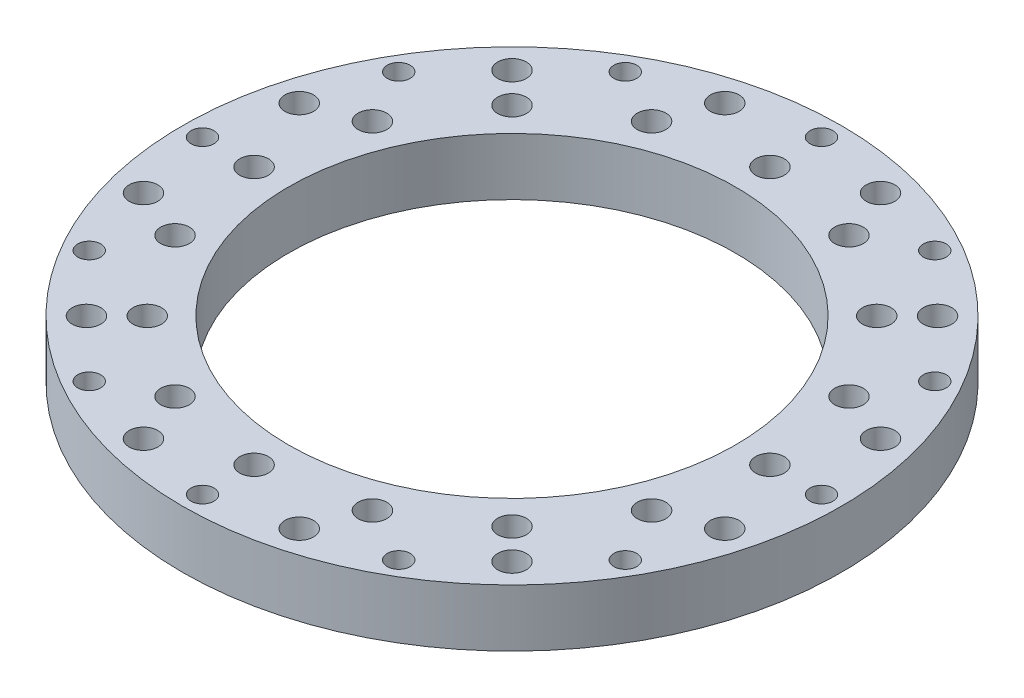
from build123d import *

# Parameters (mm, degrees)
SKETCH1_R           = 57.5
SKETCH1_R_2         = 39
SKETCH1_R_3         = 2
SKETCH1_R_4         = 2.5
BOSS_EXTRUDE1_DEPTH = 10
SKETCH2_R           = 2.5
CUT_EXTRUDE1_DEPTH  = 10
SKETCH4_R           = 5
SKETCH4_R_2         = 2.5
BOSS_EXTRUDE3_DEPTH = 0.4


with BuildPart() as part:
    # Sketch1 → Boss-Extrude1 (new body)
    with BuildSketch(Plane(origin=(0, 0, 0), x_dir=(1, 0, 0), z_dir=(0, 1, 0))):
        Circle(SKETCH1_R)
        Circle(SKETCH1_R_2, mode=Mode.SUBTRACT)
        with Locations((0, 54)):
            Circle(SKETCH1_R_3, mode=Mode.SUBTRACT)
        with Locations((27, 46.765371804)):
            Circle(SKETCH1_R_3, mode=Mode.SUBTRACT)
        with Locations((46.765371804, 27)):
            Circle(SKETCH1_R_3, mode=Mode.SUBTRACT)
        with Locations((54, 0)):
            Circle(SKETCH1_R_3, mode=Mode.SUBTRACT)
        with Locations((46.765371804, -27)):
            Circle(SKETCH1_R_3, mode=Mode.SUBTRACT)
        with Locations((27, -46.765371804)):
            Circle(SKETCH1_R_3, mode=Mode.SUBTRACT)
        with Locations((0, -54)):
            Circle(SKETCH1_R_3, mode=Mode.SUBTRACT)
        with Locations((-27, -46.765371804)):
            Circle(SKETCH1_R_3, mode=Mode.SUBTRACT)
        with Locations((-46.765371804, -27)):
            Circle(SKETCH1_R_3, mode=Mode.SUBTRACT)
        with Locations((-54, 0)):
            Circle(SKETCH1_R_3, mode=Mode.SUBTRACT)
        with Locations((-46.765371804, 27)):
            Circle(SKETCH1_R_3, mode=Mode.SUBTRACT)
        with Locations((-27, 46.765371804)):
            Circle(SKETCH1_R_3, mode=Mode.SUBTRACT)
        with Locations((13.587999868, 50.71110588)):
            Circle(SKETCH1_R_4, mode=Mode.SUBTRACT)
        with Locations((37.123106012, 37.123106012)):
            Circle(SKETCH1_R_4, mode=Mode.SUBTRACT)
        with Locations((50.71110588, 13.587999868)):
            Circle(SKETCH1_R_4, mode=Mode.SUBTRACT)
        with Locations((50.71110588, -13.587999868)):
            Circle(SKETCH1_R_4, mode=Mode.SUBTRACT)
        with Locations((37.123106012, -37.123106012)):
            Circle(SKETCH1_R_4, mode=Mode.SUBTRACT)
        with Locations((13.587999868, -50.71110588)):
            Circle(SKETCH1_R_4, mode=Mode.SUBTRACT)
        with Locations((-13.587999868, -50.71110588)):
            Circle(SKETCH1_R_4, mode=Mode.SUBTRACT)
        with Locations((-37.123106012, -37.123106012)):
            Circle(SKETCH1_R_4, mode=Mode.SUBTRACT)
        with Locations((-50.71110588, -13.587999868)):
            Circle(SKETCH1_R_4, mode=Mode.SUBTRACT)
        with Locations((-50.71110588, 13.587999868)):
            Circle(SKETCH1_R_4, mode=Mode.SUBTRACT)
        with Locations((-37.123106012, 37.123106012)):
            Circle(SKETCH1_R_4, mode=Mode.SUBTRACT)
        with Locations((-13.587999868, 50.71110588)):
            Circle(SKETCH1_R_4, mode=Mode.SUBTRACT)
    extrude(amount=BOSS_EXTRUDE1_DEPTH)

    # Sketch2 → Cut-Extrude1 (cut)
    with BuildSketch(Plane(origin=(0, 10, 0), x_dir=(1, 0, 0), z_dir=(0, 1, 0))):
        with Locations((0, 45)):
            Circle(SKETCH2_R)
        with Locations((17.220754456, 41.574578963)):
            Circle(SKETCH2_R)
        with Locations((31.819805153, 31.819805153)):
            Circle(SKETCH2_R)
        with Locations((41.574578963, 17.220754456)):
            Circle(SKETCH2_R)
        with Locations((45, 0)):
            Circle(SKETCH2_R)
        with Locations((41.574578963, -17.220754456)):
            Circle(SKETCH2_R)
        with Locations((31.819805153, -31.819805153)):
            Circle(SKETCH2_R)
        with Locations((17.220754456, -41.574578963)):
            Circle(SKETCH2_R)
        with Locations((0, -45)):
            Circle(SKETCH2_R)
        with Locations((-17.220754456, -41.574578963)):
            Circle(SKETCH2_R)
        with Locations((-31.819805153, -31.819805153)):
            Circle(SKETCH2_R)
        with Locations((-41.574578963, -17.220754456)):
            Circle(SKETCH2_R)
        with Locations((-45, 0)):
            Circle(SKETCH2_R)
        with Locations((-41.574578963, 17.220754456)):
            Circle(SKETCH2_R)
        with Locations((-31.819805153, 31.819805153)):
            Circle(SKETCH2_R)
        with Locations((-17.220754456, 41.574578963)):
            Circle(SKETCH2_R)
    extrude(amount=-CUT_EXTRUDE1_DEPTH, mode=Mode.SUBTRACT)

    # Sketch4 → Boss-Extrude3 (add)
    # profile 1 of 16: a face of its own
    with BuildSketch(Plane(origin=(0, 0, 0), x_dir=(1, 0, 0), z_dir=(0, 1, 0))):
        with Locations((0, 45)):
            Circle(SKETCH4_R)
        with Locations((0, 45)):
            Circle(SKETCH4_R_2, mode=Mode.SUBTRACT)
    # profile 2 of 16: a face of its own
    with BuildSketch(Plane(origin=(0, 0, 0), x_dir=(1, 0, 0), z_dir=(0, 1, 0))):
        with Locations((17.220754456, 41.574578963)):
            Circle(SKETCH4_R)
        with Locations((17.220754456, 41.574578963)):
            Circle(SKETCH4_R_2, mode=Mode.SUBTRACT)
    # profile 3 of 16: a face of its own
    with BuildSketch(Plane(origin=(0, 0, 0), x_dir=(1, 0, 0), z_dir=(0, 1, 0))):
        with Locations((31.819805153, 31.819805153)):
            Circle(SKETCH4_R)
        with Locations((31.819805153, 31.819805153)):
            Circle(SKETCH4_R_2, mode=Mode.SUBTRACT)
    # profile 4 of 16: a face of its own
    with BuildSketch(Plane(origin=(0, 0, 0), x_dir=(1, 0, 0), z_dir=(0, 1, 0))):
        with Locations((41.574578963, 17.220754456)):
            Circle(SKETCH4_R)
        with Locations((41.574578963, 17.220754456)):
            Circle(SKETCH4_R_2, mode=Mode.SUBTRACT)
    # profile 5 of 16: a face of its own
    with BuildSketch(Plane(origin=(0, 0, 0), x_dir=(1, 0, 0), z_dir=(0, 1, 0))):
        with Locations((45, 0)):
            Circle(SKETCH4_R)
        with Locations((45, 0)):
            Circle(SKETCH4_R_2, mode=Mode.SUBTRACT)
    # profile 6 of 16: a face of its own
    with BuildSketch(Plane(origin=(0, 0, 0), x_dir=(1, 0, 0), z_dir=(0, 1, 0))):
        with Locations((41.574578963, -17.220754456)):
            Circle(SKETCH4_R)
        with Locations((41.574578963, -17.220754456)):
            Circle(SKETCH4_R_2, mode=Mode.SUBTRACT)
    # profile 7 of 16: a face of its own
    with BuildSketch(Plane(origin=(0, 0, 0), x_dir=(1, 0, 0), z_dir=(0, 1, 0))):
        with Locations((31.819805153, -31.819805153)):
            Circle(SKETCH4_R)
        with Locations((31.819805153, -31.819805153)):
            Circle(SKETCH4_R_2, mode=Mode.SUBTRACT)
    # profile 8 of 16: a face of its own
    with BuildSketch(Plane(origin=(0, 0, 0), x_dir=(1, 0, 0), z_dir=(0, 1, 0))):
        with Locations((17.220754456, -41.574578963)):
            Circle(SKETCH4_R)
        with Locations((17.220754456, -41.574578963)):
            Circle(SKETCH4_R_2, mode=Mode.SUBTRACT)
    # profile 9 of 16: a face of its own
    with BuildSketch(Plane(origin=(0, 0, 0), x_dir=(1, 0, 0), z_dir=(0, 1, 0))):
        with Locations((0, -45)):
            Circle(SKETCH4_R)
        with Locations((0, -45)):
            Circle(SKETCH4_R_2, mode=Mode.SUBTRACT)
    # profile 10 of 16: a face of its own
    with BuildSketch(Plane(origin=(0, 0, 0), x_dir=(1, 0, 0), z_dir=(0, 1, 0))):
        with Locations((-17.220754456, -41.574578963)):
            Circle(SKETCH4_R)
        with Locations((-17.220754456, -41.574578963)):
            Circle(SKETCH4_R_2, mode=Mode.SUBTRACT)
    # profile 11 of 16: a face of its own
    with BuildSketch(Plane(origin=(0, 0, 0), x_dir=(1, 0, 0), z_dir=(0, 1, 0))):
        with Locations((-31.819805153, -31.819805153)):
            Circle(SKETCH4_R)
        with Locations((-31.819805153, -31.819805153)):
            Circle(SKETCH4_R_2, mode=Mode.SUBTRACT)
    # profile 12 of 16: a face of its own
    with BuildSketch(Plane(origin=(0, 0, 0), x_dir=(1, 0, 0), z_dir=(0, 1, 0))):
        with Locations((-41.574578963, -17.220754456)):
            Circle(SKETCH4_R)
        with Locations((-41.574578963, -17.220754456)):
            Circle(SKETCH4_R_2, mode=Mode.SUBTRACT)
    # profile 13 of 16: a face of its own
    with BuildSketch(Plane(origin=(0, 0, 0), x_dir=(1, 0, 0), z_dir=(0, 1, 0))):
        with Locations((-45, 0)):
            Circle(SKETCH4_R)
        with Locations((-45, 0)):
            Circle(SKETCH4_R_2, mode=Mode.SUBTRACT)
    # profile 14 of 16: a face of its own
    with BuildSketch(Plane(origin=(0, 0, 0), x_dir=(1, 0, 0), z_dir=(0, 1, 0))):
        with Locations((-41.574578963, 17.220754456)):
            Circle(SKETCH4_R)
        with Locations((-41.574578963, 17.220754456)):
            Circle(SKETCH4_R_2, mode=Mode.SUBTRACT)
    # profile 15 of 16: a face of its own
    with BuildSketch(Plane(origin=(0, 0, 0), x_dir=(1, 0, 0), z_dir=(0, 1, 0))):
        with Locations((-31.819805153, 31.819805153)):
            Circle(SKETCH4_R)
        with Locations((-31.819805153, 31.819805153)):
            Circle(SKETCH4_R_2, mode=Mode.SUBTRACT)
    # profile 16 of 16: a face of its own
    with BuildSketch(Plane(origin=(0, 0, 0), x_dir=(1, 0, 0), z_dir=(0, 1, 0))):
        with Locations((-17.220754456, 41.574578963)):
            Circle(SKETCH4_R)
        with Locations((-17.220754456, 41.574578963)):
            Circle(SKETCH4_R_2, mode=Mode.SUBTRACT)
    extrude(amount=-BOSS_EXTRUDE3_DEPTH)


solid = part.part
